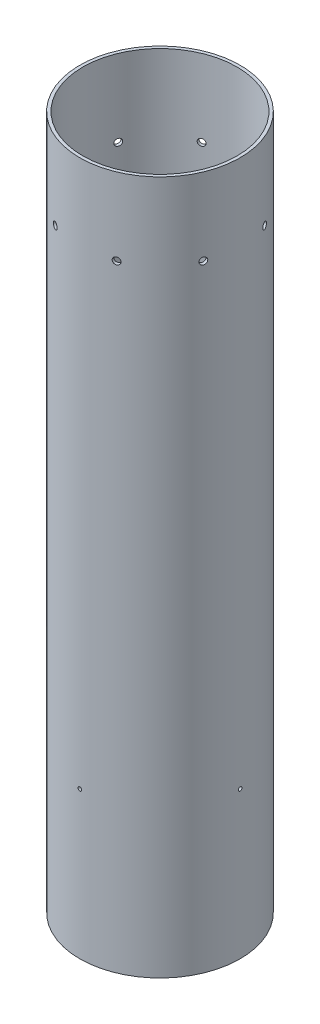
from build123d import *

# Parameters (mm, degrees)
SKETCH1_R           = 52.832
SKETCH1_R_2         = 50.8
BOSS_EXTRUDE1_DEPTH = 457.2
CIRPATTERN1_COUNT   = 4
CIRPATTERN2_COUNT   = 8


with BuildPart() as part:
    # Sketch1 → Boss-Extrude1 (new body)
    with BuildSketch(Plane(origin=(0, 0, 0), x_dir=(1, 0, 0), z_dir=(0, 1, 0))):
        Circle(SKETCH1_R)
        Circle(SKETCH1_R_2, mode=Mode.SUBTRACT)
    extrude(amount=BOSS_EXTRUDE1_DEPTH)

    # Sketch4 → #2 Clearance Hole1 (revolve, cut)
    with BuildSketch(Plane(origin=(0, 96.9772, 52.832), x_dir=(0, -1, 0), z_dir=(1, 0, 0))):
        Polygon((0, 0), (0, 55.596569267), (1.2192, 54.864), (1.2192, 0), align=None)
    f_2_clearance_hole1 = revolve(axis=Axis((0, 96.9772, 59.182), (0, 0, -1)), mode=Mode.SUBTRACT)

    # Sketch6 → #8 Clearance Hole1 (revolve, cut)
    with BuildSketch(Plane(origin=(20.217931099, 406.4, 48.810403462), x_dir=(0.9238795325112864, 0, -0.38268343236509056), z_dir=(0, 1, 0))):
        Polygon((0, 0), (0, 56.214674586), (2.2479, 54.864), (2.2479, 0), align=None)
    f_8_clearance_hole1 = revolve(axis=Axis((22.647970894, 406.4, 54.677038493), (-0.38268343236509056, 0, -0.9238795325112865)), mode=Mode.SUBTRACT)

    # CirPattern1: #2 Clearance Hole1 ×4 about axis
    cirpattern1_axis = Axis((0, 457.2, 0), (0, -1, 0))
    for i in range(1, CIRPATTERN1_COUNT):
        add(f_2_clearance_hole1.rotate(cirpattern1_axis, i * 360 / CIRPATTERN1_COUNT), mode=Mode.SUBTRACT)

    # CirPattern2: #8 Clearance Hole1 ×8 about axis
    cirpattern2_axis = Axis((0, 457.2, 0), (0, -1, 0))
    for i in range(1, CIRPATTERN2_COUNT):
        add(f_8_clearance_hole1.rotate(cirpattern2_axis, i * 360 / CIRPATTERN2_COUNT), mode=Mode.SUBTRACT)


solid = part.part
